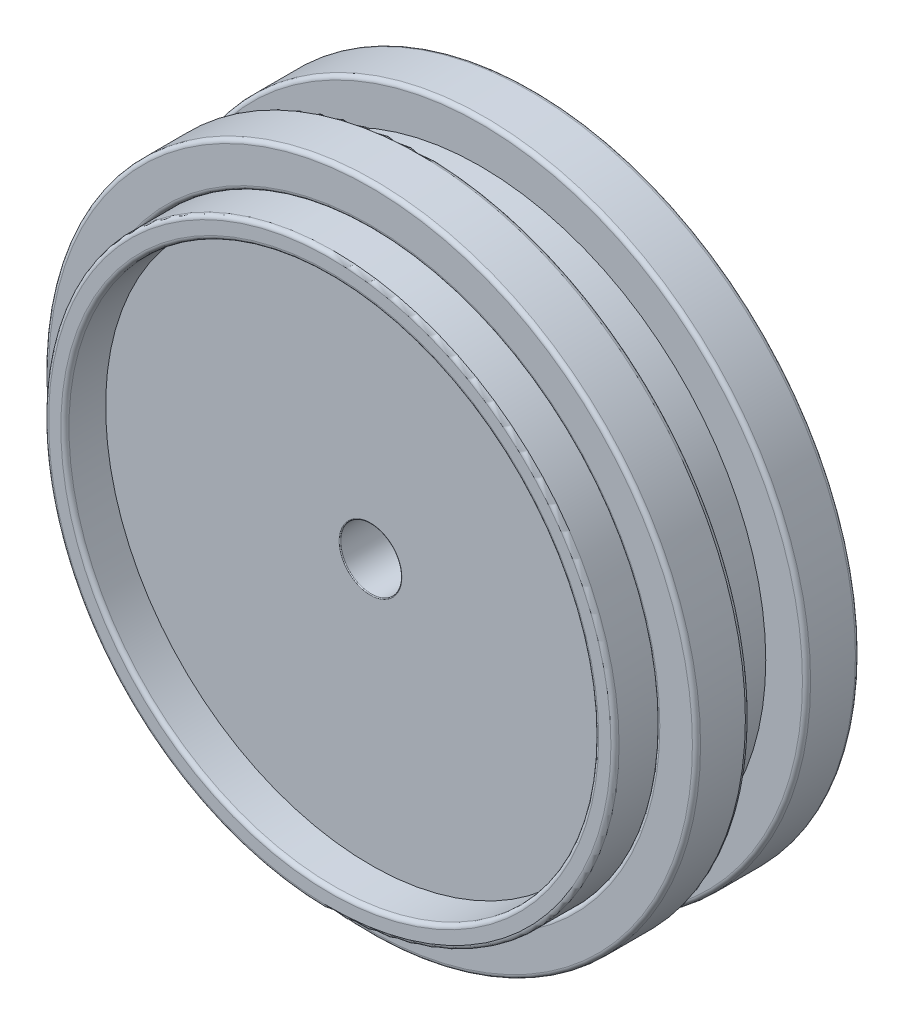
from build123d import *

# Parameters (mm, degrees)
BOSS_EXTRUDE1_DEPTH      = 12.7
BOSS_EXTRUDE1_DEPTH_BACK = 50.8
SKETCH1_R                = 88.9
SKETCH1_R_2              = 82.55
SKETCH1_3_R              = 101.6
SKETCH1_3_R_2            = 88.9
BOSS_EXTRUDE2_DEPTH      = 50.8
SKETCH1_4_R              = 82.55
BOSS_EXTRUDE3_DEPTH      = 25.4
SKETCH4_W                = 12.7
SKETCH4_H                = 17.78
SKETCH5_R                = 9.525
CUT_EXTRUDE1_DEPTH       = 44.45
FILLET1_R                = 1.27
FILLET2_R                = 1.27
FILLET6_R                = 1.27
FILLET9_R                = 0.254


with BuildPart() as part:
    # Sketch1 → Boss-Extrude1 (new, two sides: drawn at the far end of the back side and taken through both)
    with BuildSketch(Plane.XY.offset(-BOSS_EXTRUDE1_DEPTH_BACK)):
        Circle(SKETCH1_R)
        Circle(SKETCH1_R_2, mode=Mode.SUBTRACT)
    extrude(amount=BOSS_EXTRUDE1_DEPTH + BOSS_EXTRUDE1_DEPTH_BACK)

    # Fillet2
    fillet2_edges = [part.edges().sort_by_distance(p)[0] for p in [
        (-82.55, 0, -50.8),
        (-82.55, 0, 12.7),
        (-88.9, 0, 12.7),
    ]]
    fillet(fillet2_edges, radius=FILLET2_R)


with BuildPart() as body_2:
    # Sketch1<3> → Boss-Extrude2 (new body)
    with BuildSketch(Plane.XY):
        Circle(SKETCH1_3_R)
        Circle(SKETCH1_3_R_2, mode=Mode.SUBTRACT)
    extrude(amount=-BOSS_EXTRUDE2_DEPTH)

    # Sketch4 → Cut-Revolve1 (revolve, cut)
    with BuildSketch(Plane(origin=(0, 0, 0), x_dir=(1, 0, 0), z_dir=(0, 1, 0))):
        with Locations((95.25, 25.4)):
            Rectangle(SKETCH4_W, SKETCH4_H)
    revolve(axis=Axis((0, 0, 0), (0, 0, 1)), mode=Mode.SUBTRACT)


with BuildPart() as body_3:
    # Sketch1<4> → Boss-Extrude3 (new body)
    with BuildSketch(Plane.XY):
        Circle(SKETCH1_4_R)
    extrude(amount=-BOSS_EXTRUDE3_DEPTH)

    # Sketch5 → Cut-Extrude1 (cut)
    with BuildSketch(Plane.XY):
        Circle(SKETCH5_R)
    extrude(amount=-CUT_EXTRUDE1_DEPTH, mode=Mode.SUBTRACT)

    # Fillet9
    fillet9_edges = [body_3.edges().sort_by_distance(p)[0] for p in [
        (-9.525, 0, -25.4),
        (-9.525, 0, 0),
    ]]
    fillet(fillet9_edges, radius=FILLET9_R)


with BuildPart() as cut_revolve1_piece_1:
    # of the separate pieces the step leaves, piece 1, a body of its own (cut_revolve1_pieces)
    add(body_2.part.solids().sort_by_distance((101.6, 0, 0))[0])

    # Fillet1
    fillet1_edges = [cut_revolve1_piece_1.edges().sort_by_distance(p)[0] for p in [
        (-88.9, 0, 0),
        (-101.6, 0, -16.51),
        (-101.6, 0, 0),
    ]]
    fillet(fillet1_edges, radius=FILLET1_R)


with BuildPart() as cut_revolve1_piece_2:
    # of the separate pieces the step leaves, piece 2, a body of its own (cut_revolve1_pieces)
    add(body_2.part.solids().sort_by_distance((101.6, 0, -34.29))[0])

    # Fillet6
    fillet6_edges = [cut_revolve1_piece_2.edges().sort_by_distance(p)[0] for p in [
        (-101.6, 0, -50.8),
        (-101.6, 0, -34.29),
    ]]
    fillet(fillet6_edges, radius=FILLET6_R)


solid = Compound([part.part, body_3.part, cut_revolve1_piece_1.part, cut_revolve1_piece_2.part])
